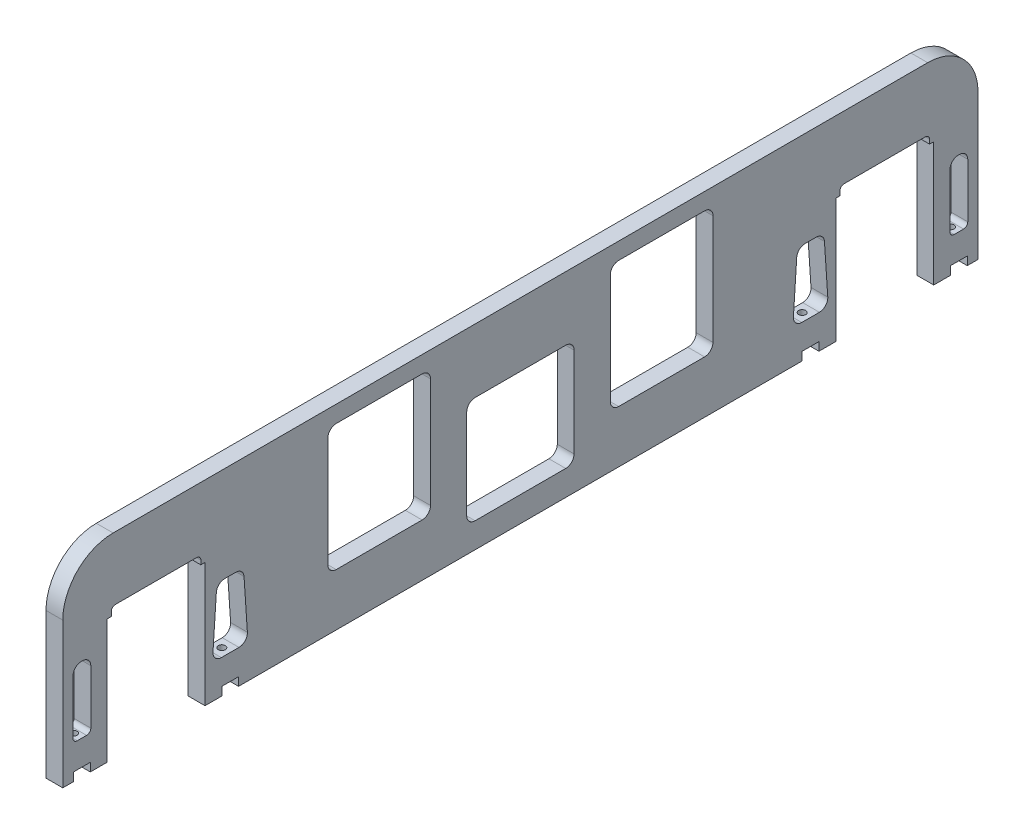
from build123d import *

# Parameters (mm, degrees)
BOSS_EXTRUDE1_DEPTH       = 6.35
FILLET1_R                 = 19.05
SKETCH2_W                 = 33.909
SKETCH2_H                 = 3.175
CUT_EXTRUDE1_DEPTH        = 189.494912836
FILLET2_R                 = 1.5875
FILLET2_OF_MIRROR1_R      = 1.5875
SKETCH3_W                 = 6.35
SKETCH3_H                 = 3.175
CUT_EXTRUDE2_DEPTH        = 189.494912836
SKETCH4_W                 = 38.862
SKETCH4_H                 = 47.879
SKETCH4_W_2               = 40.64
SKETCH4_H_2               = 40.386
CUT_EXTRUDE3_DEPTH        = 189.494912836
FILLET3_R                 = 3.175
SKETCH5_W                 = 6.731
SKETCH5_H                 = 25.24125
CUT_EXTRUDE4_DEPTH        = 189.494912836
FILLET4_R                 = 3.175
FILLET5_R                 = 1.5875
F_6_32_TAPPED_HOLE1_D     = 2.7051
F_6_32_TAPPED_HOLE1_DEPTH = 13.335
F_6_32_TAPPED_HOLE1_TIP   = 0.81269403


with BuildPart() as part:
    # Sketch1 → Boss-Extrude1 (new body)
    with BuildSketch(Plane(origin=(0, 0, 0), x_dir=(0, 0, -1), z_dir=(1, 0, 0))):
        Polygon((173.228, 74.041), (173.228, 0), (156.464, 0), (156.464, 46.99), (119.38, 46.99), (119.38, 0), (-119.38, 0), (-119.38, 46.99), (-156.464, 46.99), (-156.464, 0), (-173.228, 0), (-173.228, 74.041), align=None)
    extrude(amount=BOSS_EXTRUDE1_DEPTH)

    # Fillet1
    fillet1_edges = [part.edges().sort_by_distance(p)[0] for p in [
        (3.175, 74.041, -173.228),
        (3.175, 74.041, 173.228),
    ]]
    fillet(fillet1_edges, radius=FILLET1_R)

    # Sketch2 → Cut-Extrude1 (cut, through all)
    with BuildSketch(Plane(origin=(6.35, 0, 0), x_dir=(0, 0, -1), z_dir=(1, 0, 0))):
        with Locations((-137.922, 48.5775)):
            Rectangle(SKETCH2_W, SKETCH2_H)
    cut_extrude1 = extrude(amount=-CUT_EXTRUDE1_DEPTH, mode=Mode.SUBTRACT)

    # Fillet2
    fillet2_edges = [part.edges().sort_by_distance(p)[0] for p in [
        (3.175, 50.165, 120.9675),
        (3.175, 50.165, 154.8765),
    ]]
    fillet(fillet2_edges, radius=FILLET2_R)

    # Mirror1: Cut-Extrude1 across plane
    add(cut_extrude1.mirror(Plane.XY), mode=Mode.SUBTRACT)

    # Fillet2 of Mirror1
    fillet2_of_mirror1_edges = [part.edges().sort_by_distance(p)[0] for p in [
        (3.175, 50.165, -120.9675),
        (3.175, 50.165, -154.8765),
    ]]
    fillet(fillet2_of_mirror1_edges, radius=FILLET2_OF_MIRROR1_R)

    # Sketch3 → Cut-Extrude2 (cut, through all)
    with BuildSketch(Plane(origin=(6.35, 0, 0), x_dir=(0, 0, -1), z_dir=(1, 0, 0))):
        with Locations((-109.855, 1.5875)):
            Rectangle(SKETCH3_W, SKETCH3_H)
        with Locations((-165.989, 1.5875)):
            Rectangle(SKETCH3_W, SKETCH3_H)
    cut_extrude2 = extrude(amount=-CUT_EXTRUDE2_DEPTH, mode=Mode.SUBTRACT)

    # Mirror2: Cut-Extrude2 across plane
    add(cut_extrude2.mirror(Plane.XY), mode=Mode.SUBTRACT)

    # Sketch4 → Cut-Extrude3 (cut, through all)
    with BuildSketch(Plane(origin=(6.35, 0, 0), x_dir=(0, 0, -1), z_dir=(1, 0, 0))):
        with Locations((53.467, 43.7515)):
            Rectangle(SKETCH4_W, SKETCH4_H)
        with Locations((-53.467, 43.7515)):
            Rectangle(SKETCH4_W, SKETCH4_H)
        with Locations((0, 29.718)):
            Rectangle(SKETCH4_W_2, SKETCH4_H_2)
    extrude(amount=-CUT_EXTRUDE3_DEPTH, mode=Mode.SUBTRACT)

    # Fillet3
    fillet3_edges = [part.edges().sort_by_distance(p)[0] for p in [
        (3.175, 49.911, -20.32),
        (3.175, 49.911, 20.32),
        (3.175, 9.525, 20.32),
        (3.175, 9.525, -20.32),
        (3.175, 67.691, -72.898),
        (3.175, 19.812, -72.898),
        (3.175, 19.812, -34.036),
        (3.175, 67.691, -34.036),
        (3.175, 67.691, 72.898),
        (3.175, 67.691, 34.036),
        (3.175, 19.812, 34.036),
        (3.175, 19.812, 72.898),
    ]]
    fillet(fillet3_edges, radius=FILLET3_R)

    # Sketch5 → Cut-Extrude4 (cut, through all)
    with BuildSketch(Plane(origin=(6.35, 0, 0), x_dir=(0, 0, -1), z_dir=(1, 0, 0))):
        with Locations((165.989, 25.320625)):
            Rectangle(SKETCH5_W, SKETCH5_H)
        with Locations((-165.989, 25.320625)):
            Rectangle(SKETCH5_W, SKETCH5_H)
        Polygon((103.124, 12.7), (116.586, 12.7), (114.90325, 37.94125), (104.80675, 37.94125), align=None)
        Polygon((-103.124, 12.7), (-116.586, 12.7), (-114.90325, 37.94125), (-104.80675, 37.94125), align=None)
    extrude(amount=-CUT_EXTRUDE4_DEPTH, mode=Mode.SUBTRACT)

    # Fillet4
    fillet4_edges = [part.edges().sort_by_distance(p)[0] for p in [
        (3.175, 37.94125, 169.3545),
        (3.175, 37.94125, 162.6235),
        (3.175, 37.94125, -169.3545),
        (3.175, 37.94125, -162.6235),
        (3.175, 37.94125, -104.80675),
        (3.175, 37.94125, -114.90325),
        (3.175, 12.7, -116.586),
        (3.175, 12.7, -103.124),
        (3.175, 37.94125, 114.90325),
        (3.175, 37.94125, 104.80675),
        (3.175, 12.7, 103.124),
        (3.175, 12.7, 116.586),
    ]]
    fillet(fillet4_edges, radius=FILLET4_R)

    # Fillet5
    fillet5_edges = [part.edges().sort_by_distance(p)[0] for p in [
        (3.175, 12.7, 162.6235),
        (3.175, 12.7, 169.3545),
        (3.175, 12.7, -162.6235),
        (3.175, 12.7, -169.3545),
    ]]
    fillet(fillet5_edges, radius=FILLET5_R)

    # #6-32 Tapped Hole1
    with Locations(Plane(origin=(3.175, 3.175, 165.989), x_dir=(0, 0, -1), z_dir=(0, -1, 0))):
        with Locations((0, 0), (56.134, 0), (275.844, 0), (331.978, 0)):
            Hole(F_6_32_TAPPED_HOLE1_D / 2, depth=F_6_32_TAPPED_HOLE1_DEPTH)
            with Locations((0, 0, -(F_6_32_TAPPED_HOLE1_DEPTH + F_6_32_TAPPED_HOLE1_TIP / 2))):  # 118° drill point
                Cone(0, F_6_32_TAPPED_HOLE1_D / 2, F_6_32_TAPPED_HOLE1_TIP, mode=Mode.SUBTRACT)


solid = part.part
